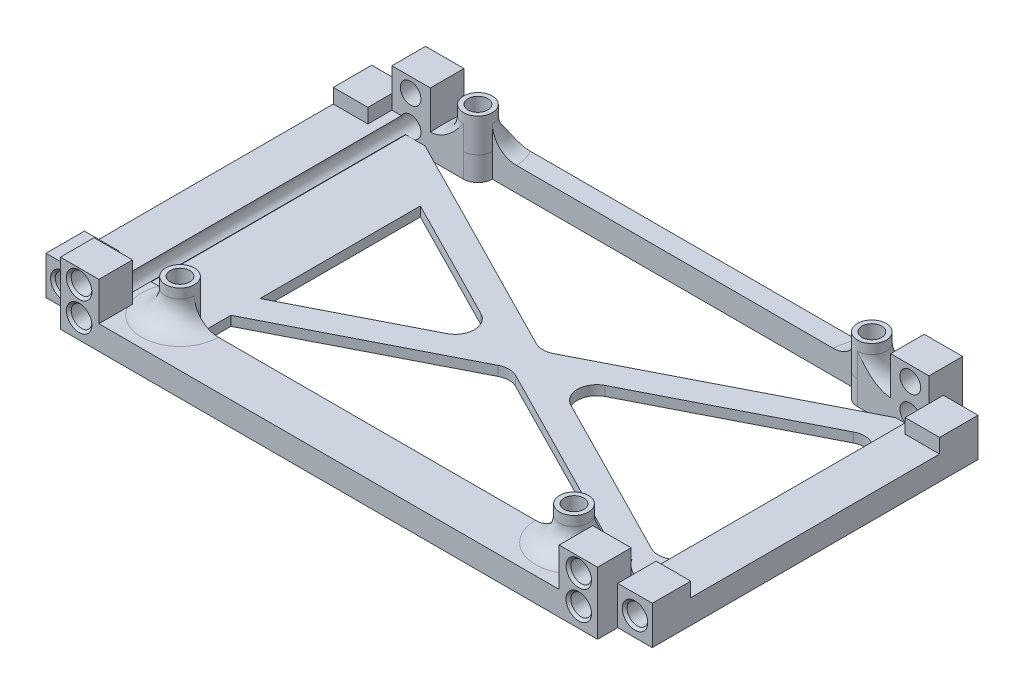
from build123d import *

# Parameters (mm, degrees)
BOSS_EXTRUDE1_DEPTH     = 5
CUT_EXTRUDE1_DEPTH      = 82.277303105
SKETCH3_R               = 3
BOSS_EXTRUDE2_DEPTH     = 7
CUT_EXTRUDE2_DEPTH      = 83.006097334
CUT_EXTRUDE2_DEPTH_BACK = 83.006097334
SKETCH4_R               = 2.05
SKETCH5_W               = 12
SKETCH5_H               = 56
CUT_EXTRUDE3_DEPTH      = 82.424811943
FILLET1_R               = 3
SKETCH7_W               = 7.2
SKETCH7_H               = 8
BOSS_EXTRUDE3_DEPTH     = 3
SKETCH8_R               = 2.15
CUT_EXTRUDE5_DEPTH      = 6
MIRROR4_COPY_1_SKETCH_W = 7.2
MIRROR4_COPY_1_SKETCH_H = 8
MIRROR4_COPY_1_DEPTH    = 3
MIRROR4_COPY_2_SKETCH_R = 2.15
MIRROR4_COPY_2_DEPTH    = 6
SKETCH10_W              = 111.8
SKETCH10_H              = 1
CUT_EXTRUDE7_DEPTH      = 82.424811943
CUT_EXTRUDE9_DEPTH      = 81.925892025
CUT_EXTRUDE9_DEPTH_BACK = 81.925892025
SKETCH13_W              = 111.8
SKETCH13_H              = 0.6
SKETCH13_H_2            = 0.4
SKETCH14_W              = 8
SKETCH14_H              = 8.5
BOSS_EXTRUDE5_DEPTH     = 8
SKETCH15_R              = 2.15
CUT_EXTRUDE10_DEPTH     = 107.348483769
SKETCH16_W              = 111.8
SKETCH16_H              = 1.5
CUT_EXTRUDE11_DEPTH     = 82.468767021
FILLET2_R               = 5
BOSS_EXTRUDE6_DEPTH     = 2
FILLET3_R               = 4
CHAMFER1_SIZE           = 0.5
SKETCH18_W              = 14.326545163
SKETCH18_H              = 51.270973558
BOSS_EXTRUDE7_DEPTH     = 2
SKETCH19_W              = 6.9
SKETCH19_H              = 67.8
CUT_EXTRUDE12_DEPTH     = 81.09750314


# Some blends are built 0.0001 mm under size
with BuildPart() as part:
    # Sketch1 → Boss-Extrude1 (new body)
    with BuildSketch(Plane(origin=(0, 0, 0), x_dir=(1, 0, 0), z_dir=(0, 1, 0))):
        Polygon((-70, -33.9), (-70, 33.9), (-55.9, 33.9), (-55.9, 41), (55.9, 41), (55.9, 33.9), (70, 33.9), (70, -33.9), (55.9, -33.9), (55.9, -41), (-55.9, -41), (-55.9, -33.9), align=None)
    extrude(amount=BOSS_EXTRUDE1_DEPTH)

    # Sketch2 → Cut-Extrude1 (cut, through all)
    with BuildSketch(Plane(origin=(0, 5, 0), x_dir=(1, 0, 0), z_dir=(0, 1, 0))):
        Polygon((-41, 30.9), (-38, 30.9), (-38, 33.9), (38, 33.9), (38, 30.9), (41, 30.9), (41, -25.1), (38, -25.1), (38, -28.1), (-38, -28.1), (-38, -25.1), (-41, -25.1), align=None)
    extrude(amount=-CUT_EXTRUDE1_DEPTH, mode=Mode.SUBTRACT)

    # Sketch3 → Boss-Extrude2 (add)
    with BuildSketch(Plane(origin=(0, 5, 0), x_dir=(1, 0, 0), z_dir=(0, 1, 0))):
        with Locations(Location((-41, -28.1, 0), (0, 0, 90))):
            Circle(SKETCH3_R)
        with Locations(Location((41, -28.1, 0), (0, 0, 90))):
            Circle(SKETCH3_R)
        with Locations(Location((41, 33.9, 0), (0, 0, 270))):
            Circle(SKETCH3_R)
        with Locations(Location((-41, 33.9, 0), (0, 0, 270))):
            Circle(SKETCH3_R)
    extrude(amount=BOSS_EXTRUDE2_DEPTH)

    # Sketch4 → Cut-Extrude2 (cut, two sides: drawn at the far end of the back side and taken through both)
    with BuildSketch(Plane(origin=(0, 12, 0), x_dir=(1, 0, 0), z_dir=(0, 1, 0)).offset(-CUT_EXTRUDE2_DEPTH_BACK)):
        with Locations(Location((-41, 33.9, 0), (0, 0, 270))):
            Circle(SKETCH4_R)
        with Locations(Location((41, 33.9, 0), (0, 0, 270))):
            Circle(SKETCH4_R)
        with Locations(Location((41, -28.1, 0), (0, 0, 270))):
            Circle(SKETCH4_R)
        with Locations(Location((-41, -28.1, 0), (0, 0, 270))):
            Circle(SKETCH4_R)
    extrude(amount=CUT_EXTRUDE2_DEPTH + CUT_EXTRUDE2_DEPTH_BACK, mode=Mode.SUBTRACT)

    # Sketch5 → Cut-Extrude3 (cut, through all)
    with BuildSketch(Plane(origin=(0, 5, 0), x_dir=(1, 0, 0), z_dir=(0, 1, 0))):
        with Locations((-47, 2.9)):
            Rectangle(SKETCH5_W, SKETCH5_H)
        with Locations((47, 2.9)):
            Rectangle(SKETCH5_W, SKETCH5_H)
    extrude(amount=-CUT_EXTRUDE3_DEPTH, mode=Mode.SUBTRACT)

    # Fillet1
    fillet1_edges = [part.edges().sort_by_distance(p)[0] for p in [
        (38, 2.5, 25.1),
        (-38, 2.5, 25.1),
        (38, 2.5, -30.9),
        (-38, 2.5, -30.9),
    ]]
    fillet(fillet1_edges, radius=FILLET1_R - 0.0001)  # a hair under: the kernel refuses the full size

    # Sketch7 → Boss-Extrude3 (add)
    with BuildSketch(Plane(origin=(0, 5, 0), x_dir=(1, 0, 0), z_dir=(0, 1, 0))):
        with Locations((59.5, 29.9)):
            Rectangle(SKETCH7_W, SKETCH7_H)
    boss_extrude3 = extrude(amount=BOSS_EXTRUDE3_DEPTH)

    # Sketch8 → Cut-Extrude5 (cut)
    with BuildSketch(Plane(origin=(0, 0, -33.9), x_dir=(-1, 0, 0), z_dir=(0, 0, -1))):
        with Locations((-59.5, 4)):
            Circle(SKETCH8_R)
    cut_extrude5 = extrude(amount=-CUT_EXTRUDE5_DEPTH, mode=Mode.SUBTRACT)

    # Mirror3: Boss-Extrude3, Cut-Extrude5 across plane
    add(boss_extrude3.mirror(Plane(origin=(0, 0, 0), x_dir=(0, 0, 1), z_dir=(1, 0, 0))))
    add(cut_extrude5.mirror(Plane(origin=(0, 0, 0), x_dir=(0, 0, 1), z_dir=(1, 0, 0))), mode=Mode.SUBTRACT)

    # Mirror4: Boss-Extrude3, Cut-Extrude5 across plane
    add(boss_extrude3.mirror(Plane.XY))
    add(cut_extrude5.mirror(Plane.XY), mode=Mode.SUBTRACT)

    # Mirror4 copy 1 sketch → Mirror4 copy 1 (add)
    with BuildSketch(Plane(origin=(0, 5, 0), x_dir=(-1, 0, 0), z_dir=(0, 1, 0))):
        with Locations((59.5, 29.9)):
            Rectangle(MIRROR4_COPY_1_SKETCH_W, MIRROR4_COPY_1_SKETCH_H)
    extrude(amount=MIRROR4_COPY_1_DEPTH)

    # Mirror4 copy 2 sketch → Mirror4 copy 2 (cut)
    with BuildSketch(Plane.XY.offset(33.9)):
        with Locations((-59.5, 4)):
            Circle(MIRROR4_COPY_2_SKETCH_R)
    extrude(amount=-MIRROR4_COPY_2_DEPTH, mode=Mode.SUBTRACT)

    # Sketch10 → Cut-Extrude7 (cut, through all)
    with BuildSketch(Plane(origin=(0, 5, 0), x_dir=(1, 0, 0), z_dir=(0, 1, 0))):
        with Locations((0, 40.5)):
            Rectangle(SKETCH10_W, SKETCH10_H)
        with Locations((0, -40.5)):
            Rectangle(SKETCH10_W, SKETCH10_H)
    extrude(amount=-CUT_EXTRUDE7_DEPTH, mode=Mode.SUBTRACT)

    # Sketch13 → Cut-Extrude9 (cut, two sides: drawn at the far end of the back side and taken through both)
    with BuildSketch(Plane(origin=(0, 5, 0), x_dir=(1, 0, 0), z_dir=(0, 1, 0)).offset(-CUT_EXTRUDE9_DEPTH_BACK)):
        with Locations((0, 39.7)):
            Rectangle(SKETCH13_W, SKETCH13_H)
        with Locations((0, -39.8)):
            Rectangle(SKETCH13_W, SKETCH13_H_2)
    extrude(amount=CUT_EXTRUDE9_DEPTH + CUT_EXTRUDE9_DEPTH_BACK, mode=Mode.SUBTRACT)

    # Sketch14 → Boss-Extrude5 (add)
    with BuildSketch(Plane(origin=(0, 5, 0), x_dir=(1, 0, 0), z_dir=(0, 1, 0))):
        with Locations((-51.9, -35.35)):
            Rectangle(SKETCH14_W, SKETCH14_H)
        with Locations((-51.9, 35.15)):
            Rectangle(SKETCH14_W, SKETCH14_H)
    boss_extrude5 = extrude(amount=BOSS_EXTRUDE5_DEPTH)

    # Sketch15 → Cut-Extrude10 (cut, through all)
    with BuildSketch(Plane.XY.offset(39.6)):
        with Locations((-52, 4)):
            Circle(SKETCH15_R)
        with Locations((-52, 10)):
            Circle(SKETCH15_R)
    cut_extrude10 = extrude(amount=-CUT_EXTRUDE10_DEPTH, mode=Mode.SUBTRACT)

    # Mirror5: Boss-Extrude5, Cut-Extrude10 across plane
    add(boss_extrude5.mirror(Plane(origin=(0, 0, 0), x_dir=(0, 0, 1), z_dir=(1, 0, 0))))
    add(cut_extrude10.mirror(Plane(origin=(0, 0, 0), x_dir=(0, 0, 1), z_dir=(1, 0, 0))), mode=Mode.SUBTRACT)

    # Sketch16 → Cut-Extrude11 (cut, through all)
    with BuildSketch(Plane(origin=(0, 13, 0), x_dir=(1, 0, 0), z_dir=(0, 1, 0))):
        with Locations((0, 38.65)):
            Rectangle(SKETCH16_W, SKETCH16_H)
        with Locations((0, -38.85)):
            Rectangle(SKETCH16_W, SKETCH16_H)
    extrude(amount=-CUT_EXTRUDE11_DEPTH, mode=Mode.SUBTRACT)

    # Fillet2
    # the kernel refuses this fillet: 5 mm, written as the material it adds along each edge
    with BuildSketch(Plane(origin=(41, 5, -33.9), x_dir=(0, 0, 1), z_dir=(-1, 0, 0))) as fillet2_piece_1_section:
        with BuildLine():
            CenterArc((3 + FILLET2_R, FILLET2_R), FILLET2_R, 180, 90)
            Line((3, FILLET2_R), (3, 0))
            Line((3, 0), (3 + FILLET2_R, 0))
        make_face()
    fillet2_piece_1 = revolve(axis=Axis((41, 5, -33.9), (0, 1, 0)), revolution_arc=270, mode=Mode.PRIVATE)
    fillet2_piece_1 = split(fillet2_piece_1, bisect_by=Plane(origin=(44.491512461, 6.175351369, -37.9), z_dir=(0, 0, 1)), keep=Keep.TOP, mode=Mode.PRIVATE)
    fillet2_piece_1 = split(fillet2_piece_1, bisect_by=Plane(origin=(44.491512461, 6.175351369, -30.9), z_dir=(0, 0, -1)), keep=Keep.TOP, mode=Mode.PRIVATE)
    add(fillet2_piece_1)
    with BuildSketch(Plane(origin=(-41, 5, -33.9), x_dir=(1, 0, 0), z_dir=(0, 0, 1))) as fillet2_piece_2_section:
        with BuildLine():
            CenterArc((3 + FILLET2_R, FILLET2_R), FILLET2_R, 180, 90)
            Line((3 + FILLET2_R, 0), (3, 0))
            Line((3, 0), (3, FILLET2_R))
        make_face()
    fillet2_piece_2 = revolve(axis=Axis((-41, 5, -33.9), (0, 1, 0)), revolution_arc=270, mode=Mode.PRIVATE)
    fillet2_piece_2 = split(fillet2_piece_2, bisect_by=Plane(origin=(-38.284053436, 8.700964466, -30.9), z_dir=(0, 0, -1)), keep=Keep.TOP, mode=Mode.PRIVATE)
    fillet2_piece_2 = split(fillet2_piece_2, bisect_by=Plane(origin=(-38.284053436, 8.700964466, -37.9), z_dir=(0, 0, 1)), keep=Keep.TOP, mode=Mode.PRIVATE)
    add(fillet2_piece_2)
    with BuildSketch(Plane(origin=(41, 5, 28.1), x_dir=(-1, 0, 0), z_dir=(0, 0, -1))) as fillet2_piece_3_section:
        with BuildLine():
            CenterArc((3 + FILLET2_R, FILLET2_R), FILLET2_R, 180, 90)
            Line((3, FILLET2_R), (3, 0))
            Line((3, 0), (3 + FILLET2_R, 0))
        make_face()
    fillet2_piece_3 = revolve(axis=Axis((41, 5, 28.1), (0, 1, 0)), revolution_arc=270, mode=Mode.PRIVATE)
    fillet2_piece_3 = split(fillet2_piece_3, bisect_by=Plane(origin=(36.873263977, 5.893445035, 25.1), z_dir=(0, 0, 1)), keep=Keep.TOP, mode=Mode.PRIVATE)
    add(fillet2_piece_3)
    with BuildSketch(Plane(origin=(-41, 5, 28.1), x_dir=(0, 0, -1), z_dir=(1, 0, 0))) as fillet2_piece_4_section:
        with BuildLine():
            CenterArc((3 + FILLET2_R, FILLET2_R), FILLET2_R, 180, 90)
            Line((3, FILLET2_R), (3, 0))
            Line((3, 0), (3 + FILLET2_R, 0))
        make_face()
    fillet2_piece_4 = revolve(axis=Axis((-41, 5, 28.1), (0, 1, 0)), revolution_arc=270, mode=Mode.PRIVATE)
    fillet2_piece_4 = split(fillet2_piece_4, bisect_by=Plane(origin=(-44.491512461, 6.175351369, 25.1), z_dir=(0, 0, 1)), keep=Keep.TOP, mode=Mode.PRIVATE)
    add(fillet2_piece_4)

    # Sketch17 → Boss-Extrude6 (add)
    with BuildSketch(Plane.XZ):
        Polygon((-53, 21.1), (-5.923076923, -2.9), (-53, -26.9), (-53, -30.9), (-49, -30.9), (0, -5.919607843), (49, -30.9), (53, -30.9), (53, -26.9), (5.923076923, -2.9), (53, 21.1), (53, 25.1), (49, 25.1), (0, 0.119607843), (-49, 25.1), (-53, 25.1), align=None)
    extrude(amount=-BOSS_EXTRUDE6_DEPTH)

    # Fillet3
    fillet3_edges = [part.edges().sort_by_distance(p)[0] for p in [
        (-53, 1, 21.1),
        (0, 1, 0.119607843),
        (53, 1, 21.1),
        (5.923076923, 1, -2.9),
        (53, 1, -26.9),
        (0, 1, -5.919607843),
        (-53, 1, -26.9),
        (-5.923076923, 1, -2.9),
    ]]
    fillet(fillet3_edges, radius=FILLET3_R)

    # Chamfer1
    chamfer1_edges = [part.edges().sort_by_distance(p)[0] for p in [
        (61.65, 4, -33.9),
        (-61.65, 4, -33.9),
        (-61.65, 4, 33.9),
        (61.65, 4, 33.9),
        (-54.15, 10, -37.9),
        (-54.15, 4, -37.9),
        (54.15, 4, -37.9),
        (54.15, 10, -37.9),
        (-54.15, 4, 38.1),
        (-54.15, 10, 38.1),
        (54.15, 10, 38.1),
        (54.15, 4, 38.1),
    ]]
    chamfer(chamfer1_edges, length=CHAMFER1_SIZE)

    # Sketch18 → Boss-Extrude7 (add)
    with BuildSketch(Plane(origin=(0, 2, 0), x_dir=(1, 0, 0), z_dir=(0, 1, 0))):
        with Locations((-45.836727419, 0)):
            Rectangle(SKETCH18_W, SKETCH18_H)
    extrude(amount=-BOSS_EXTRUDE7_DEPTH)

    # Sketch19 → Cut-Extrude12 (cut, through all)
    with BuildSketch(Plane(origin=(0, 5, 0), x_dir=(1, 0, 0), z_dir=(0, 1, 0))):
        with Locations((-66.55, 0)):
            Rectangle(SKETCH19_W, SKETCH19_H)
        with Locations((66.55, 0)):
            Rectangle(SKETCH19_W, SKETCH19_H)
    extrude(amount=-CUT_EXTRUDE12_DEPTH, mode=Mode.SUBTRACT)


solid = part.part
